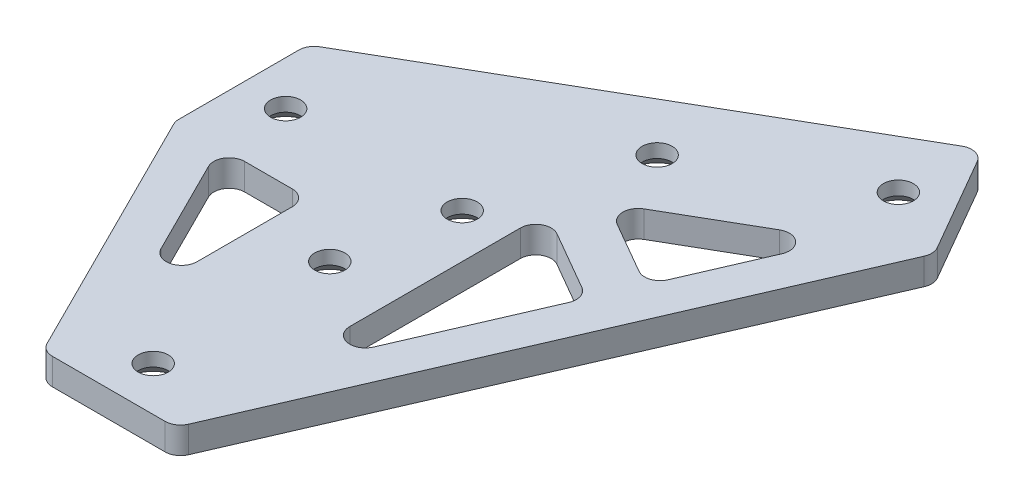
from build123d import *

# Parameters (mm, degrees)
SKETCH_4_R                   = 1.6
EXTRUDE_1_DEPTH              = 1.5
CUT_EXTRUDE_2_DEPTH          = 3
FILLET_2_R                   = 1.75
HOLE_WIZARD_M3_1_D           = 3.4
HOLE_WIZARD_M3_1_DEPTH       = 5.978536948
HOLE_WIZARD_M3_1_CSINK_D     = 6.3
HOLE_WIZARD_M3_1_CSINK_ANGLE = 90
HOLE_WIZARD_M3_1_TIP         = 1.021463052


with BuildPart() as part:
    # ｽｹｯﾁ4 → ﾎﾞｽ - 押し出し1 (new, symmetric)
    with BuildSketch(Plane(origin=(0, 0, 0), x_dir=(1, 0, 0), z_dir=(0, 1, 0))):
        Polygon((-30, 0), (-30, 15), (18.480762114, 42.990381057), (25.980762114, 30), (0, -30), (-15, -30), align=None)
        with Locations((0.580127019, 23.995190528)):
            Circle(SKETCH_4_R, mode=Mode.SUBTRACT)
        with Locations((-5, 7.5)):
            Circle(SKETCH_4_R, mode=Mode.SUBTRACT)
        with Locations((-7.5, -5)):
            Circle(SKETCH_4_R, mode=Mode.SUBTRACT)
        with Locations((-7.5, -25)):
            Circle(SKETCH_4_R, mode=Mode.SUBTRACT)
        with Locations((-25, 7.5)):
            Circle(SKETCH_4_R, mode=Mode.SUBTRACT)
        with Locations((17.900635095, 33.995190528)):
            Circle(SKETCH_4_R, mode=Mode.SUBTRACT)
    extrude(amount=EXTRUDE_1_DEPTH, both=True)

    # ｽｹｯﾁ5 → ｶｯﾄ - 押し出し2 (cut)
    with BuildSketch(Plane(origin=(0, 1.5, 0), x_dir=(1, 0, 0), z_dir=(0, 1, 0))):
        Polygon((-15, 0), (-24.968847051, 0), (-15, -19.937694101), align=None)
        Polygon((0, -18.675248347), (10.665448219, 5.955549254), (0, 12.113248654), align=None)
        Polygon((12.665448219, 10.574351407), (19.442413698, 26.225082782), (2.5, 16.443375673), align=None)
    extrude(amount=-CUT_EXTRUDE_2_DEPTH, mode=Mode.SUBTRACT)

    # ﾌｨﾚｯﾄ2
    fillet_2_edges = [part.edges().sort_by_distance(p)[0] for p in [
        (-15, 0, 19.937694101),
        (0, 0, 18.675248347),
        (10.665448219, 0, -5.955549254),
        (12.665448219, 0, -10.574351407),
        (2.5, 0, -16.443375673),
        (19.442413698, 0, -26.225082782),
        (-24.968847051, 0, 0),
        (-15, 0, 30),
        (0, 0, 30),
        (25.980762114, 0, -30),
        (18.480762114, 0, -42.990381057),
        (-30, 0, -15),
        (-30, 0, 0),
        (0, 0, -12.113248654),
        (-15, 0, 0),
    ]]
    fillet(fillet_2_edges, radius=FILLET_2_R)

    # M3 丸皿ねじ用皿穴1
    with Locations(Plane(origin=(-7.5, -1.5, 25), x_dir=(0, 0, -1), z_dir=(0, -1, 0))):
        with Locations((0, 0), (20, 0), (32.5, -17.5), (32.5, 2.5), (48.995190528, 8.080127019), (58.995190528, 25.400635095)):
            CounterSinkHole(HOLE_WIZARD_M3_1_D / 2, HOLE_WIZARD_M3_1_CSINK_D / 2, depth=HOLE_WIZARD_M3_1_DEPTH, counter_sink_angle=HOLE_WIZARD_M3_1_CSINK_ANGLE)
            with Locations((0, 0, -(HOLE_WIZARD_M3_1_DEPTH + HOLE_WIZARD_M3_1_TIP / 2))):  # 118° drill point
                Cone(0, HOLE_WIZARD_M3_1_D / 2, HOLE_WIZARD_M3_1_TIP, mode=Mode.SUBTRACT)


solid = part.part
